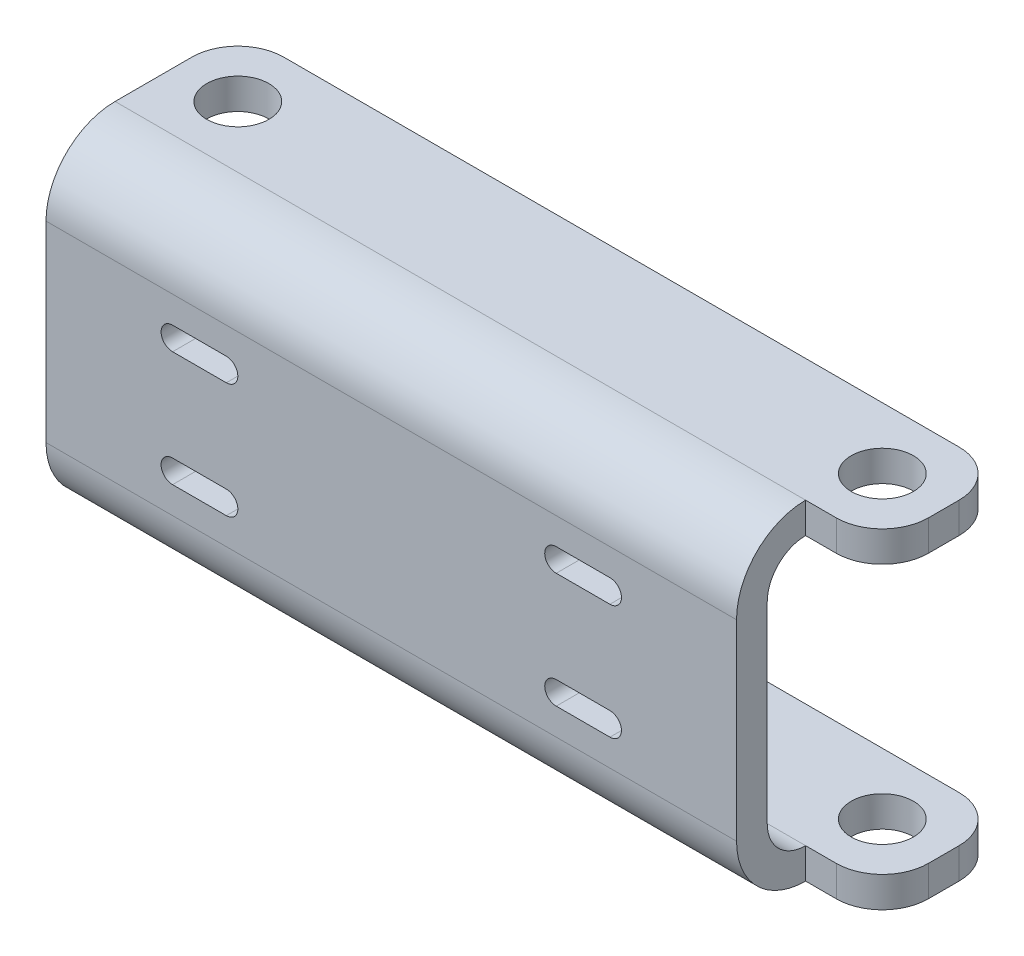
from build123d import *

# Parameters (mm, degrees)
SM_BASE_FLANGE_1_DEPTH = 100
SKETCH_4_R             = 4.05
CUT_EXTRUDE_1_DEPTH    = 112.687062814
SKETCH_5_W             = 10
SKETCH_5_H             = 9
CUT_EXTRUDE_2_DEPTH    = 112.687062814
FILLET_1_R             = 6
CUT_EXTRUDE_3_DEPTH    = 4


# Sheet-metal steps are written as plain solids
with BuildPart() as part:
    # Sketch 1 → Базовая кромка1 (new body)
    with BuildSketch(Plane(origin=(0, 0, 0), x_dir=(0, 0, -1), z_dir=(1, 0, 0))):
        with BuildLine():
            Line((25, -43), (9, -43))
            ThreePointArc((9, -43), (2.636038969, -40.363961031), (0, -34))
            Line((0, -34), (0, -9))
            ThreePointArc((0, -9), (2.636038969, -2.636038969), (9, 0))
            Line((9, 0), (25, 0))
            Line((25, 0), (25, -4))
            Line((25, -4), (9, -4))
            ThreePointArc((9, -4), (5.464466094, -5.464466094), (4, -9))
            Line((4, -9), (4, -34))
            ThreePointArc((4, -34), (5.464466094, -37.535533906), (9, -39))
            Line((9, -39), (25, -39))
            Line((25, -39), (25, -43))
        make_face()
    extrude(amount=SM_BASE_FLANGE_1_DEPTH)

    # Эскиз4 → Вырез-Вытянуть1 (cut, through all)
    with BuildSketch(Plane(origin=(0, 0, 0), x_dir=(1, 0, 0), z_dir=(0, 1, 0))):
        with Locations(Location((8, 17, 0), (0, 0, 270))):
            Circle(SKETCH_4_R)
        with Locations(Location((92, 17, 0), (0, 0, 270))):
            Circle(SKETCH_4_R)
    extrude(amount=-CUT_EXTRUDE_1_DEPTH, mode=Mode.SUBTRACT)

    # Эскиз5 → Вырез-Вытянуть2 (cut, through all)
    with BuildSketch(Plane.XZ.offset(43)):
        with Locations((95, -4.5)):
            Rectangle(SKETCH_5_W, SKETCH_5_H)
    extrude(amount=-CUT_EXTRUDE_2_DEPTH, mode=Mode.SUBTRACT)

    # Скругление1
    fillet_1_edges = [part.edges().sort_by_distance(p)[0] for p in [
        (0, -41, -25),
        (0, -2, -25),
        (100, -41, -25),
        (100, -2, -9),
        (100, -41, -9),
        (100, -2, -25),
    ]]
    fillet(fillet_1_edges, radius=FILLET_1_R)

    # Эскиз6 → Вырез-Вытянуть3 (cut)
    with BuildSketch(Plane.XY):
        with BuildLine():
            Line((16.5, -12.5), (23.5, -12.5))
            ThreePointArc((23.5, -12.5), (25, -14), (23.5, -15.5))
            Line((23.5, -15.5), (16.5, -15.5))
            ThreePointArc((16.5, -15.5), (15, -14), (16.5, -12.5))
        make_face()
        with BuildLine():
            Line((73.5, -12.5), (66.5, -12.5))
            ThreePointArc((66.5, -12.5), (65, -14), (66.5, -15.5))
            Line((66.5, -15.5), (73.5, -15.5))
            ThreePointArc((73.5, -15.5), (75, -14), (73.5, -12.5))
        make_face()
        with BuildLine():
            Line((73.5, -30.5), (66.5, -30.5))
            ThreePointArc((66.5, -30.5), (65, -29), (66.5, -27.5))
            Line((66.5, -27.5), (73.5, -27.5))
            ThreePointArc((73.5, -27.5), (75, -29), (73.5, -30.5))
        make_face()
        with BuildLine():
            Line((16.5, -30.5), (23.5, -30.5))
            ThreePointArc((23.5, -30.5), (25, -29), (23.5, -27.5))
            Line((23.5, -27.5), (16.5, -27.5))
            ThreePointArc((16.5, -27.5), (15, -29), (16.5, -30.5))
        make_face()
    extrude(amount=-CUT_EXTRUDE_3_DEPTH, mode=Mode.SUBTRACT)


solid = part.part
